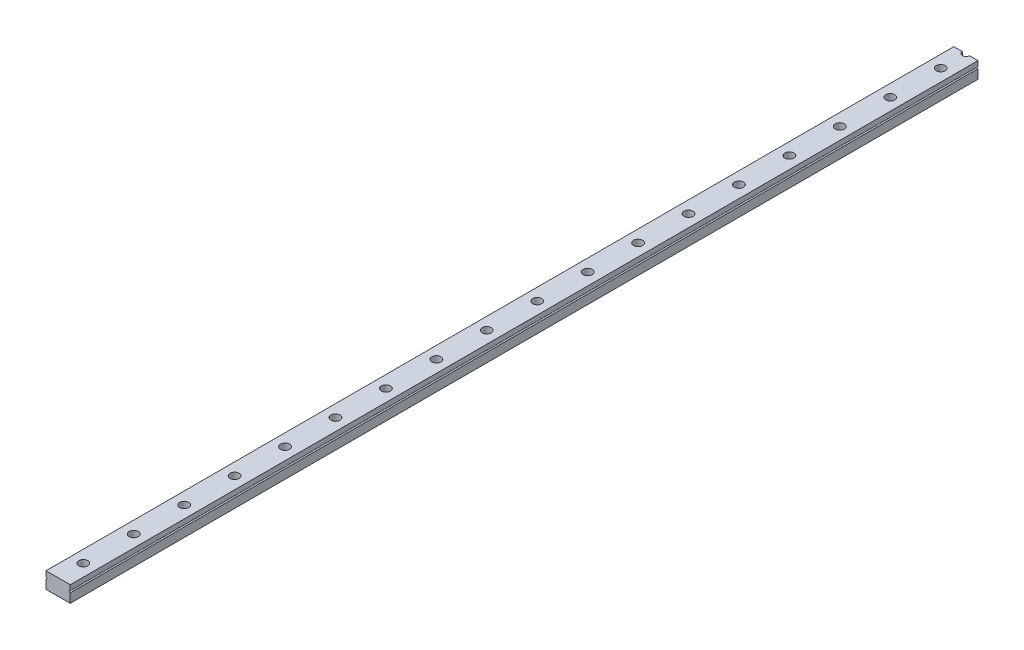
from build123d import *

# Parameters (mm, degrees)
BOSS_EXTRUDE1_DEPTH             = 450
RAILHOLES_SKETCH1_R             = 1.75
RAILHOLES_CUT_EXTRUDE1_DEPTH    = 451.231051795
RAILBOREHOLESSKETCH1_R          = 2.25
RAILBOREHOLESCUT_EXTRUDE1_DEPTH = 4


with BuildPart() as part:
    # Rail-Sketch1 → Boss-Extrude1 (new body)
    with BuildSketch(Plane.XY):
        with BuildLine():
            Line((0, 0), (12, 0))
            Line((12, 0), (12, 4.499999912))
            ThreePointArc((12, 4.499999912), (11.500000044, 4.999999956), (12, 5.5))
            Line((12, 5.5), (12, 8))
            Line((12, 8), (0, 8))
            Line((0, 8), (0, 5.5))
            ThreePointArc((0, 5.5), (0.500000044, 4.999999956), (0, 4.499999912))
            Line((0, 4.499999912), (0, 0))
        make_face()
    extrude(amount=BOSS_EXTRUDE1_DEPTH)

    # RailHoles-Sketch1 → RailHoles-Cut-Extrude1 (cut, through all)
    with BuildSketch(Plane(origin=(0, 8, 0), x_dir=(1, 0, 0), z_dir=(0, 1, 0))):
        with Locations((6, -437.5)):
            Circle(RAILHOLES_SKETCH1_R)
        with Locations((6, -412.5)):
            Circle(RAILHOLES_SKETCH1_R)
        with Locations((6, -387.5)):
            Circle(RAILHOLES_SKETCH1_R)
        with Locations((6, -362.5)):
            Circle(RAILHOLES_SKETCH1_R)
        with Locations((6, -337.5)):
            Circle(RAILHOLES_SKETCH1_R)
        with Locations((6, -312.5)):
            Circle(RAILHOLES_SKETCH1_R)
        with Locations((6, -287.5)):
            Circle(RAILHOLES_SKETCH1_R)
        with Locations((6, -262.5)):
            Circle(RAILHOLES_SKETCH1_R)
        with Locations((6, -237.5)):
            Circle(RAILHOLES_SKETCH1_R)
        with Locations((6, -212.5)):
            Circle(RAILHOLES_SKETCH1_R)
        with Locations((6, -187.5)):
            Circle(RAILHOLES_SKETCH1_R)
        with Locations((6, -162.5)):
            Circle(RAILHOLES_SKETCH1_R)
        with Locations((6, -137.5)):
            Circle(RAILHOLES_SKETCH1_R)
        with Locations((6, -112.5)):
            Circle(RAILHOLES_SKETCH1_R)
        with Locations((6, -87.5)):
            Circle(RAILHOLES_SKETCH1_R)
        with Locations((6, -62.5)):
            Circle(RAILHOLES_SKETCH1_R)
        with Locations((6, -37.5)):
            Circle(RAILHOLES_SKETCH1_R)
        with Locations((6, -12.5)):
            Circle(RAILHOLES_SKETCH1_R)
        with Locations((6, 0)):
            Circle(RAILHOLES_SKETCH1_R)
    extrude(amount=-RAILHOLES_CUT_EXTRUDE1_DEPTH, mode=Mode.SUBTRACT)

    # RailBoreHolesSketch1 → RailBoreHolesCut-Extrude1 (cut)
    with BuildSketch(Plane(origin=(0, 8, 0), x_dir=(1, 0, 0), z_dir=(0, 1, 0))):
        with Locations((6, -437.5)):
            Circle(RAILBOREHOLESSKETCH1_R)
        with Locations((6, -412.5)):
            Circle(RAILBOREHOLESSKETCH1_R)
        with Locations((6, -387.5)):
            Circle(RAILBOREHOLESSKETCH1_R)
        with Locations((6, -362.5)):
            Circle(RAILBOREHOLESSKETCH1_R)
        with Locations((6, -337.5)):
            Circle(RAILBOREHOLESSKETCH1_R)
        with Locations((6, -312.5)):
            Circle(RAILBOREHOLESSKETCH1_R)
        with Locations((6, -287.5)):
            Circle(RAILBOREHOLESSKETCH1_R)
        with Locations((6, -262.5)):
            Circle(RAILBOREHOLESSKETCH1_R)
        with Locations((6, -237.5)):
            Circle(RAILBOREHOLESSKETCH1_R)
        with Locations((6, -212.5)):
            Circle(RAILBOREHOLESSKETCH1_R)
        with Locations((6, -187.5)):
            Circle(RAILBOREHOLESSKETCH1_R)
        with Locations((6, -162.5)):
            Circle(RAILBOREHOLESSKETCH1_R)
        with Locations((6, -137.5)):
            Circle(RAILBOREHOLESSKETCH1_R)
        with Locations((6, -112.5)):
            Circle(RAILBOREHOLESSKETCH1_R)
        with Locations((6, -87.5)):
            Circle(RAILBOREHOLESSKETCH1_R)
        with Locations((6, -62.5)):
            Circle(RAILBOREHOLESSKETCH1_R)
        with Locations((6, -37.5)):
            Circle(RAILBOREHOLESSKETCH1_R)
        with Locations((6, -12.5)):
            Circle(RAILBOREHOLESSKETCH1_R)
    extrude(amount=-RAILBOREHOLESCUT_EXTRUDE1_DEPTH, mode=Mode.SUBTRACT)


solid = part.part
